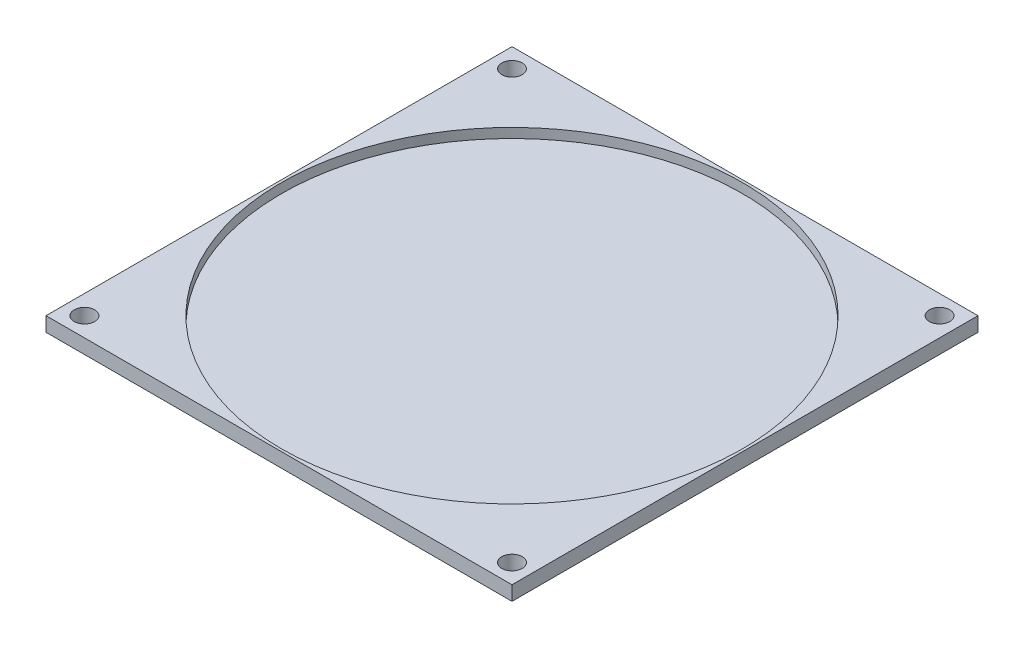
from build123d import *

# Parameters (mm, degrees)
SKETCH2_W           = 154.0002
SKETCH2_H           = 154.0002
BOSS_EXTRUDE1_DEPTH = 4.7625
SKETCH4_R           = 76.2
CUT_EXTRUDE1_DEPTH  = 3.175
SKETCH5_R           = 3.3782
CUT_EXTRUDE2_DEPTH  = 218.841237158


with BuildPart() as part:
    # Sketch2 → Boss-Extrude1 (new body)
    with BuildSketch(Plane(origin=(0, 0, 0), x_dir=(1, 0, 0), z_dir=(0, 1, 0))):
        with Locations((77.0001, 77.0001)):
            Rectangle(SKETCH2_W, SKETCH2_H)
    extrude(amount=BOSS_EXTRUDE1_DEPTH)

    # Sketch4 → Cut-Extrude1 (cut)
    with BuildSketch(Plane(origin=(0, 4.7625, 0), x_dir=(1, 0, 0), z_dir=(0, 1, 0))):
        with Locations((77.0001, 77.0001)):
            Circle(SKETCH4_R)
    extrude(amount=-CUT_EXTRUDE1_DEPTH, mode=Mode.SUBTRACT)

    # Sketch5 → Cut-Extrude2 (cut, through all)
    with BuildSketch(Plane(origin=(0, 4.7625, 0), x_dir=(1, 0, 0), z_dir=(0, 1, 0))):
        with Locations((6.35, 6.35)):
            Circle(SKETCH5_R)
        with Locations((6.35, 147.6502)):
            Circle(SKETCH5_R)
        with Locations((147.6502, 147.6502)):
            Circle(SKETCH5_R)
        with Locations((147.6502, 6.35)):
            Circle(SKETCH5_R)
    extrude(amount=-CUT_EXTRUDE2_DEPTH, mode=Mode.SUBTRACT)


solid = part.part
